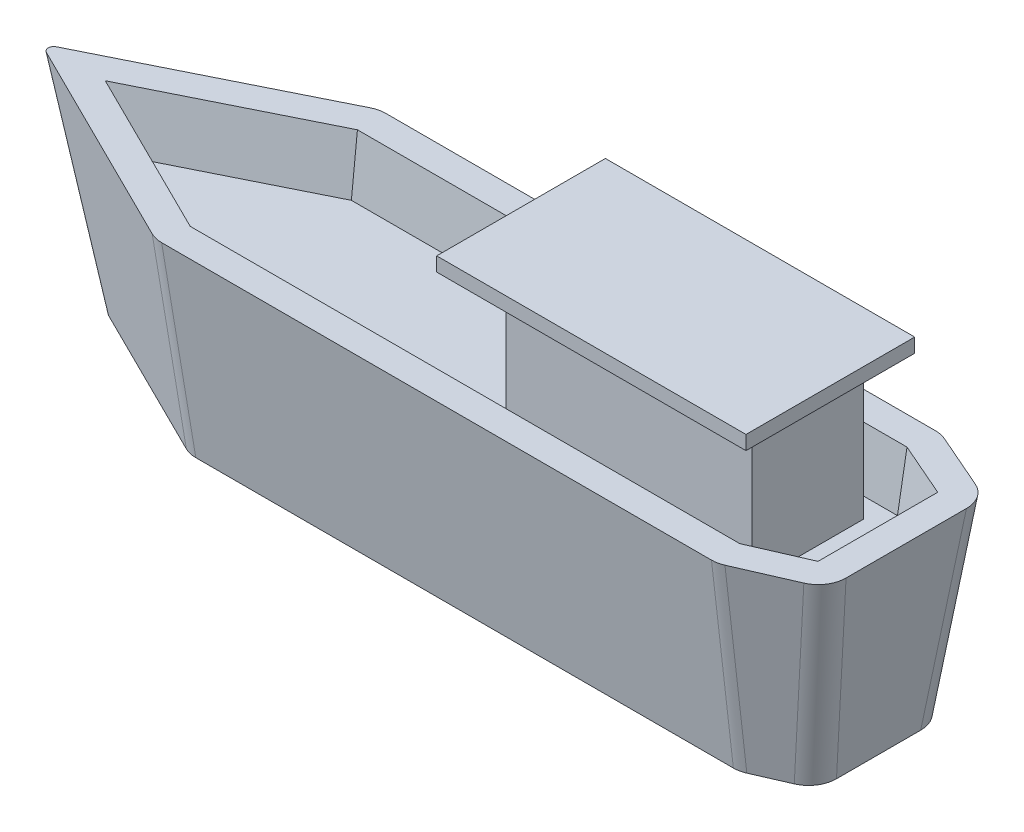
from build123d import *

# Parameters (mm, degrees)
SALIENTE_EXTRUIR1_DEPTH = 70
CHAFL_N1_SIZE           = 71.153697224
CHAFL_N1_SIZE_2         = 10
CHAFL_N2_SIZE           = 10
CHAFL_N2_SIZE_2         = 71.153697224
CHAFL_N3_SIZE           = 10
CHAFL_N3_SIZE_2         = 71.153697224
CHAFL_N4_SIZE           = 10
CHAFL_N4_SIZE_2         = 71.153697224
CHAFL_N6_SIZE           = 10
CHAFL_N6_SIZE_2         = 71.153697224
CHAFL_N7_SIZE           = 71.153697224
CHAFL_N7_SIZE_2         = 10
CHAFL_N8_SIZE           = 10
CHAFL_N8_SIZE_2         = 71.153697224
VACIADO2_DEPTH          = 20
VACIADO2_DRAFT          = -8
CROQUIS3_W              = 87.591071548
CROQUIS3_H              = 39.675716858
SALIENTE_EXTRUIR3_DEPTH = 30
CROQUIS4_W              = 110
CROQUIS4_H              = 60
SALIENTE_EXTRUIR4_DEPTH = 5
REDONDEO2_R             = 2
REDONDEO4_R             = 10
REDONDEO5_R             = 10


# Read off the part's stored shape, not the designer's step: Vaciado2
with BuildPart() as part:
    # Croquis1 → Saliente-Extruir1 (new body)
    with BuildSketch(Plane(origin=(0, 0, 0), x_dir=(1, 0, 0), z_dir=(0, 1, 0))):
        Polygon((100, -40), (-100, -40), (-180.622577483, 0), (-100, 40), (100, 40), (127.49545417, 28), (127.49545417, -28), align=None)
    extrude(amount=SALIENTE_EXTRUIR1_DEPTH)

    # Chaflán1
    # the kernel refuses this chamfer: 71.153697224, 10 mm, written as the material it takes off along each edge
    with BuildSketch(Plane(origin=(284.933017826, 0, 40), x_dir=(0, 0.999985663281603, 0.005354739139527623), z_dir=(-1, 0, 0))) as chafl_n1_piece_1:
        Polygon((CHAFL_N1_SIZE * 0.999985663279, CHAFL_N1_SIZE * 0.00535473913952), (-CHAFL_N1_SIZE_2 * 0.00535473913953, CHAFL_N1_SIZE_2 * 0.999985663282), (0, 0), align=None)
    extrude(amount=569.866035651, mode=Mode.SUBTRACT)

    # Chaflán2
    # the kernel refuses this chamfer: 71.153697224, 10 mm, written as the material it takes off along each edge
    with BuildSketch(Plane(origin=(45.508539616, 0, 112.192452367), x_dir=(0.4289599478157497, -0.26166085119417803, -0.8645964157468197), z_dir=(-0.895806416477617, 0, -0.44444444444444353))) as chafl_n2_piece_1:
        Polygon((CHAFL_N2_SIZE * 0.965159882585, -CHAFL_N2_SIZE * 0.261660851194), (-CHAFL_N2_SIZE_2 * 0.261660851194, -CHAFL_N2_SIZE_2 * 0.965159882583), (0, 0), align=None)
    extrude(amount=437.366035651, mode=Mode.SUBTRACT)

    # Chaflán3
    # the kernel refuses this chamfer: 71.153697224, 10 mm, written as the material it takes off along each edge
    with BuildSketch(Plane(origin=(-335.03676147, 0, 76.61088931), x_dir=(0.4289599478157518, -0.2616608511941785, 0.8645964157468186), z_dir=(0.895806416477616, 0, -0.4444444444444457))) as chafl_n3_piece_1:
        Polygon((CHAFL_N3_SIZE * 0.965159882585, -CHAFL_N3_SIZE * 0.261660851194), (-CHAFL_N3_SIZE_2 * 0.261660851194, -CHAFL_N3_SIZE_2 * 0.965159882583), (0, 0), align=None)
    extrude(amount=447.307518774, mode=Mode.SUBTRACT)

    # Chaflán4
    # the kernel refuses this chamfer: 71.153697224, 10 mm, written as the material it takes off along each edge
    with BuildSketch(Plane(origin=(-262.433017825, 0, -40), x_dir=(0, -0.26166085119417826, 0.9651598825854388), z_dir=(1, 0, 0))) as chafl_n4_piece_1:
        Polygon((CHAFL_N4_SIZE * 0.965159882585, -CHAFL_N4_SIZE * 0.261660851194), (-CHAFL_N4_SIZE_2 * 0.261660851194, -CHAFL_N4_SIZE_2 * 0.965159882583), (0, 0), align=None)
    extrude(amount=547.366035651, mode=Mode.SUBTRACT)

    # Chaflán6
    # the kernel refuses this chamfer: 71.153697224, 10 mm, written as the material it takes off along each edge
    with BuildSketch(Plane(origin=(-46.581032062, 0, -103.97320713), x_dir=(-0.3860639530341748, -0.2616608511941783, 0.8845836439364931), z_dir=(0.9165151389911683, 0, 0.3999999999999993))) as chafl_n6_piece_1:
        Polygon((CHAFL_N6_SIZE * 0.965159882585, -CHAFL_N6_SIZE * 0.261660851194), (-CHAFL_N6_SIZE_2 * 0.261660851194, -CHAFL_N6_SIZE_2 * 0.965159882583), (0, 0), align=None)
    extrude(amount=374.866035651, mode=Mode.SUBTRACT)

    # Chaflán7
    # the kernel refuses this chamfer: 71.153697224, 10 mm, written as the material it takes off along each edge
    with BuildSketch(Plane(origin=(296.989364706, 0, -45.97320713), x_dir=(0.002141895655810909, 0.999985663281603, 0.004907699486725296), z_dir=(-0.9165151389911683, 0, 0.3999999999999993))) as chafl_n7_piece_1:
        Polygon((CHAFL_N7_SIZE * 0.999985663279, CHAFL_N7_SIZE * 0.00535473913952), (-CHAFL_N7_SIZE_2 * 0.00535473913953, CHAFL_N7_SIZE_2 * 0.999985663282), (0, 0), align=None)
    extrude(amount=374.866035651, mode=Mode.SUBTRACT)

    # Chaflán8
    # the kernel refuses this chamfer: 71.153697224, 10 mm, written as the material it takes off along each edge
    with BuildSketch(Plane(origin=(127.49545417, 0, -202.022123314), x_dir=(-0.9651598825854388, -0.26166085119417826, 0), z_dir=(0, 0, 1))) as chafl_n8_piece_1:
        Polygon((CHAFL_N8_SIZE * 0.965159882585, -CHAFL_N8_SIZE * 0.261660851194), (-CHAFL_N8_SIZE_2 * 0.261660851194, -CHAFL_N8_SIZE_2 * 0.965159882583), (0, 0), align=None)
    extrude(amount=404.044246628, mode=Mode.SUBTRACT)


with BuildPart() as vaciado2_tool:
    # Vaciado2 outline → Vaciado2 (with draft: the straight prism first)
    with BuildSketch(Plane(origin=(0, 50, 0), x_dir=(1, 0, 0), z_dir=(0, 1, 0))):
        Polygon((114.42422018, 19.442868688), (97.271874618, 26.92876601), (-96.935637901, 26.92876601), (-151.212301005, 0), (-96.935637901, -26.92876601), (97.271874618, -26.92876601), (114.42422018, -19.442868688), align=None)
    extrude(amount=VACIADO2_DEPTH)
    # Vaciado2: the draft: its side faces are tilted about the plane it starts from
    vaciado2_sides = [vaciado2_tool.faces().sort_by_distance(p)[0] for p in [
        (105.848047399, 60, -23.185817349),
        (0.168118358, 60, -26.92876601),
        (-124.073969453, 60, -13.464383005),
        (-124.073969453, 60, 13.464383005),
        (0.168118358, 60, 26.92876601),
        (105.848047399, 60, 23.185817349),
        (114.42422018, 60, 0),
    ]]
    draft(vaciado2_sides, Plane(origin=(0, 50, 0), x_dir=(1, 0, 0), z_dir=(0, 1, 0)), VACIADO2_DRAFT)


with BuildPart() as part_1:
    add(part.part)

    # Vaciado2: cut by vaciado2_tool
    add(vaciado2_tool.part, mode=Mode.SUBTRACT)

    # Croquis3 → Saliente-Extruir3 (add, symmetric)
    with BuildSketch(Plane(origin=(0, 70, 0), x_dir=(1, 0, 0), z_dir=(0, 1, 0))):
        with Locations((48.537776825, 0)):
            Rectangle(CROQUIS3_W, CROQUIS3_H)
    extrude(amount=SALIENTE_EXTRUIR3_DEPTH, both=True)

    # Croquis4 → Saliente-Extruir4 (add)
    with BuildSketch(Plane(origin=(0, 100, 0), x_dir=(1, 0, 0), z_dir=(0, 1, 0))):
        with Locations((45.333312599, 0)):
            Rectangle(CROQUIS4_W, CROQUIS4_H)
    extrude(amount=SALIENTE_EXTRUIR4_DEPTH)

    # Redondeo2
    redondeo2_edges = [part_1.edges().sort_by_distance(p)[0] for p in [
        (-169.190168216, 35, 0),
    ]]
    fillet(redondeo2_edges, radius=REDONDEO2_R)

    # Redondeo4
    redondeo4_edges = [part_1.edges().sort_by_distance(p)[0] for p in [
        (98.939518779, 35, -34.918929215),
        (98.939518779, 35, 34.918929215),
        (122.414383384, 35, -24.673658359),
        (122.414383384, 35, 24.673658359),
    ]]
    fillet(redondeo4_edges, radius=REDONDEO4_R)

    # Redondeo5
    redondeo5_edges = [part_1.edges().sort_by_distance(p)[0] for p in [
        (-98.80881631, 35, 34.918929215),
        (-98.80881631, 35, -34.918929215),
    ]]
    fillet(redondeo5_edges, radius=REDONDEO5_R)


solid = part_1.part
